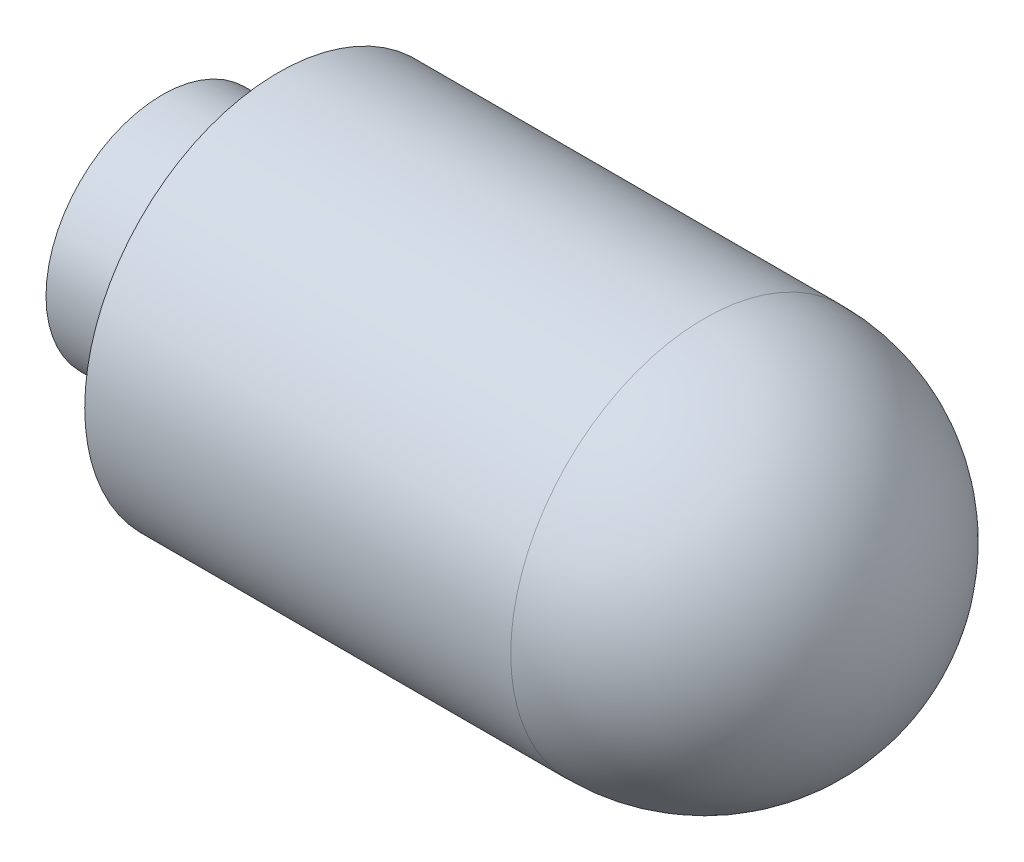
from build123d import *

# Parameters (mm, degrees)
CONG_1_R = 2.5


with BuildPart() as part:
    # Esquisse1 → Révolution1 (revolve)
    with BuildSketch(Plane.XY):
        Polygon((0, 0), (0, 1.5), (1.5, 1.5), (1.5, 2.5), (9.5, 2.5), (9.5, 0), align=None)
    revolve(axis=Axis((-4.214245494, 0, 0), (1, 0, 0)))

    # Congé1
    cong_1_edges = [part.edges().sort_by_distance(p)[0] for p in [
        (9.5, -2.5, 0),
    ]]
    fillet(cong_1_edges, radius=CONG_1_R)


solid = part.part
